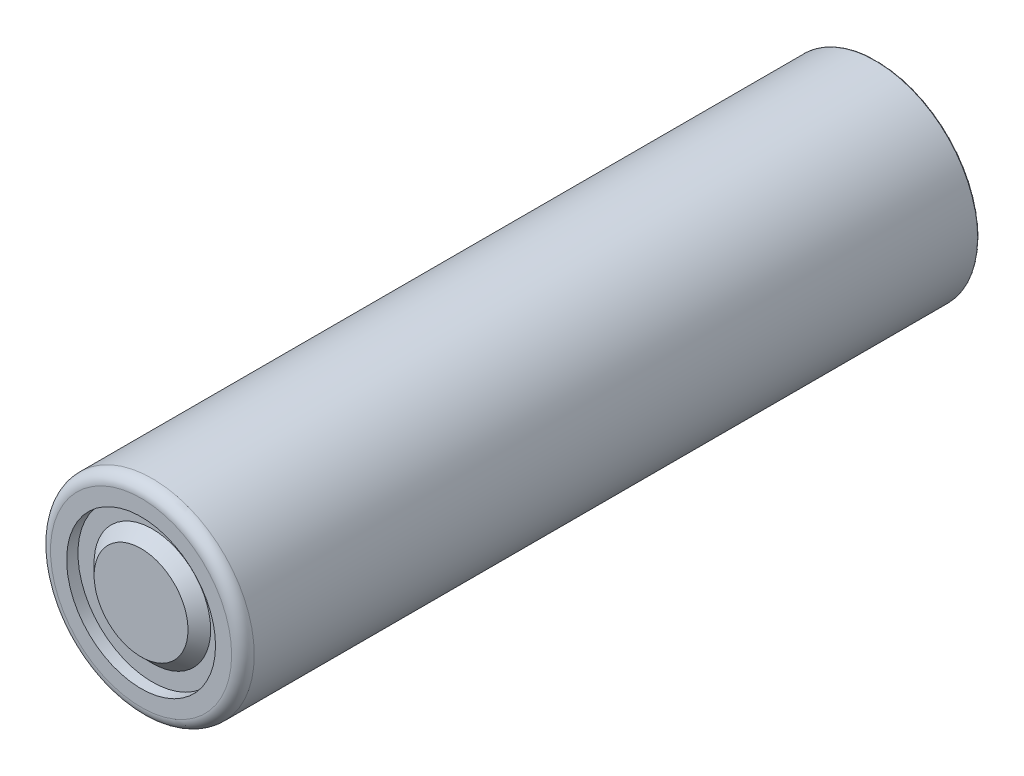
from build123d import *

# Parameters (mm, degrees)
SKETCH1_R           = 9
BOSS_EXTRUDE1_DEPTH = 65
SKETCH2_R           = 6.576456623
SKETCH2_R_2         = 5.146719103
CUT_EXTRUDE2_DEPTH  = 1
FILLET1_R           = 1
CHAMFER1_SIZE       = 1
SKETCH3_R           = 8.24633038
SKETCH3_R_2         = 7.786680871
CUT_EXTRUDE3_DEPTH  = 0.4
FILLET2_R           = 0.1


with BuildPart() as part:
    # Sketch1 → Boss-Extrude1 (new body)
    with BuildSketch(Plane.XY):
        Circle(SKETCH1_R)
    extrude(amount=BOSS_EXTRUDE1_DEPTH)

    # Sketch2 → Cut-Extrude2 (cut)
    with BuildSketch(Plane.XY.offset(65)):
        Circle(SKETCH2_R)
        Circle(SKETCH2_R_2, mode=Mode.SUBTRACT)
    extrude(amount=-CUT_EXTRUDE2_DEPTH, mode=Mode.SUBTRACT)

    # Fillet1
    fillet1_edges = [part.edges().sort_by_distance(p)[0] for p in [
        (-9, 0, 65),
    ]]
    fillet(fillet1_edges, radius=FILLET1_R)

    # Chamfer1
    chamfer1_edges = [part.edges().sort_by_distance(p)[0] for p in [
        (-5.146719103, 0, 65),
    ]]
    chamfer(chamfer1_edges, length=CHAMFER1_SIZE - 0.0001)  # a hair under: the kernel refuses the full size

    # Sketch3 → Cut-Extrude3 (cut)
    with BuildSketch(Plane(origin=(0, 0, 0), x_dir=(-1, 0, 0), z_dir=(0, 0, -1))):
        Circle(SKETCH3_R)
        Circle(SKETCH3_R_2, mode=Mode.SUBTRACT)
    extrude(amount=-CUT_EXTRUDE3_DEPTH, mode=Mode.SUBTRACT)

    # Fillet2
    fillet2_edges = [part.edges().sort_by_distance(p)[0] for p in [
        (-9, 0, 0),
    ]]
    fillet(fillet2_edges, radius=FILLET2_R)


solid = part.part
